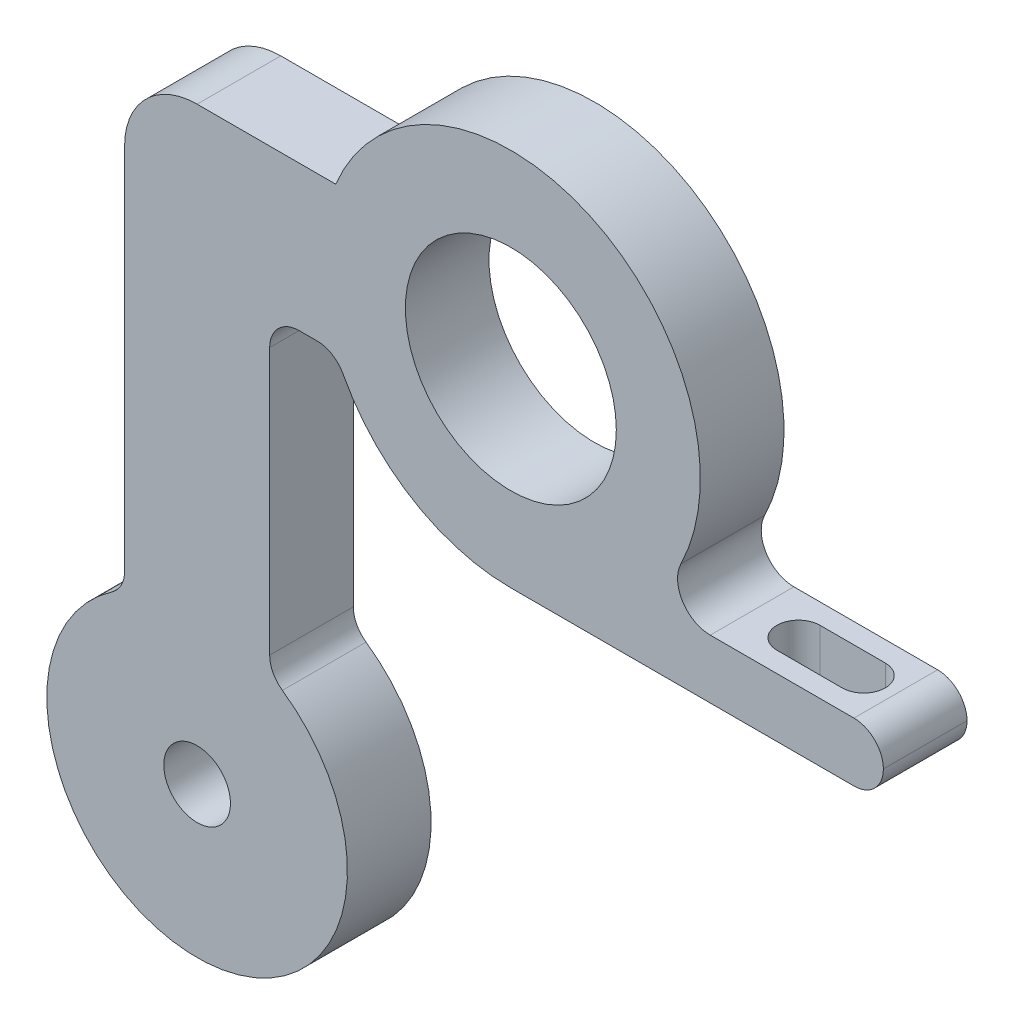
from build123d import *

# Parameters (mm, degrees)
SKETCH1_R           = 2.55
SKETCH1_R_2         = 8.07
BOSS_EXTRUDE3_DEPTH = 6.4
CUT_EXTRUDE1_DEPTH  = 16
FILLET1_R           = 2.5
FILLET2_R           = 2.25


with BuildPart() as part:
    # Sketch1 → Boss-Extrude3 (new body)
    with BuildSketch(Plane.XY):
        with BuildLine():
            ThreePointArc((-5.55, 10.072114972), (0, -11.5), (5.55, 10.072114972))
            Line((5.55, 10.072114972), (5.55, 33.95))
            Line((5.55, 33.95), (10.604198419, 33.95))
            ThreePointArc((10.604198419, 33.95), (15.944722227, 27.443362824), (24, 25))
            Line((24, 25), (52.5, 25))
            Line((52.5, 25), (52.5, 29.5))
            Line((52.5, 29.5), (34.5, 29.5))
            ThreePointArc((34.5, 29.5), (31.908668769, 51.65331059), (10.604198419, 45.05))
            Line((10.604198419, 45.05), (0, 45.05))
            ThreePointArc((0, 45.05), (-3.924442636, 43.424442636), (-5.55, 39.5))
            Line((-5.55, 39.5), (-5.55, 10.072114972))
        make_face()
        Circle(SKETCH1_R, mode=Mode.SUBTRACT)
        with Locations((24, 39.5)):
            Circle(SKETCH1_R_2, mode=Mode.SUBTRACT)
    extrude(amount=BOSS_EXTRUDE3_DEPTH)

    # Sketch2 → Cut-Extrude1 (cut)
    with BuildSketch(Plane(origin=(0, 29.5, 0), x_dir=(1, 0, 0), z_dir=(0, 1, 0))):
        with BuildLine():
            Line((42.8, -1.55), (47.8, -1.55))
            ThreePointArc((47.8, -1.55), (49.45, -3.2), (47.8, -4.85))
            Line((47.8, -4.85), (42.8, -4.85))
            ThreePointArc((42.8, -4.85), (41.15, -3.2), (42.8, -1.55))
        make_face()
    extrude(amount=-CUT_EXTRUDE1_DEPTH, mode=Mode.SUBTRACT)

    # Fillet1
    fillet1_edges = [part.edges().sort_by_distance(p)[0] for p in [
        (34.5, 29.5, 3.2),
    ]]
    fillet(fillet1_edges, radius=FILLET1_R)

    # Fillet2
    fillet2_edges = [part.edges().sort_by_distance(p)[0] for p in [
        (10.604198419, 33.95, 3.2),
        (-5.55, 10.072114972, 3.2),
        (5.55, 10.072114972, 3.2),
        (5.55, 33.95, 3.2),
        (52.5, 25, 3.2),
        (52.5, 29.5, 3.2),
    ]]
    fillet(fillet2_edges, radius=FILLET2_R - 0.0001)  # a hair under: the kernel refuses the full size


solid = part.part
